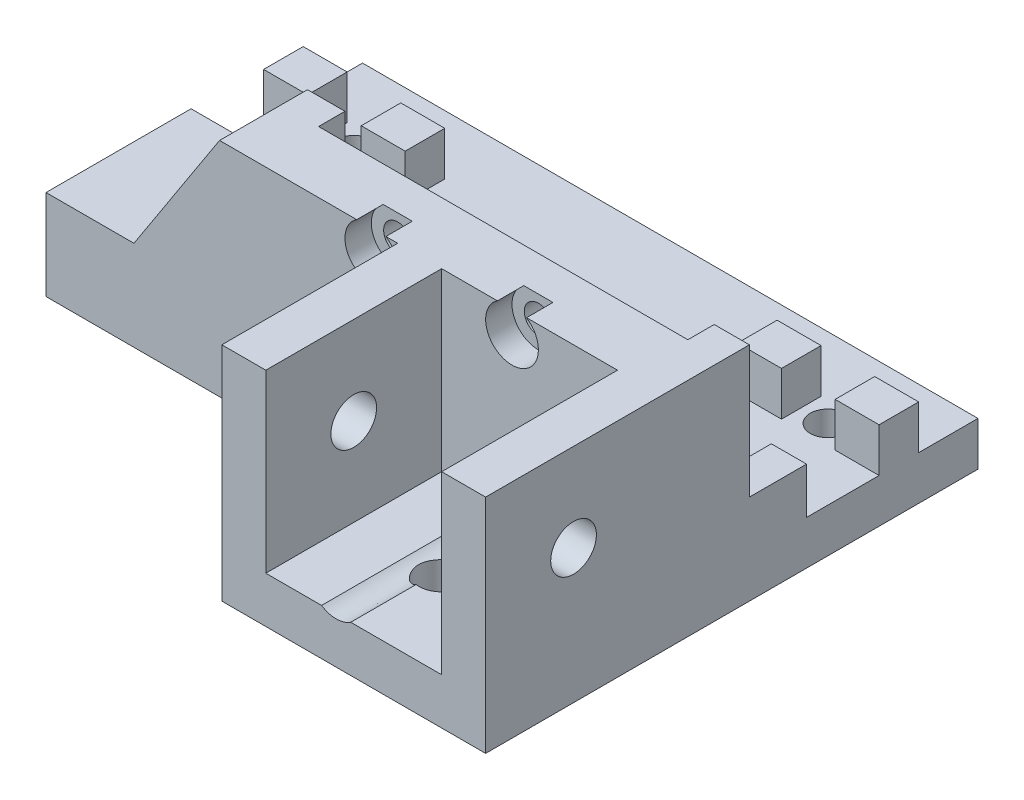
from build123d import *

# Parameters (mm, degrees)
SKETCH1_W           = 40
SKETCH1_H           = 20
SKETCH1_R           = 1.6
BOSS_EXTRUDE1_DEPTH = 7
BOSS_EXTRUDE2_DEPTH = 5
BOSS_EXTRUDE3_DEPTH = 5
BOSS_EXTRUDE4_DEPTH = 0.25
SKETCH5_W           = 50
SKETCH5_H           = 36
BOSS_EXTRUDE5_DEPTH = 5
SKETCH6_R           = 3
CUT_EXTRUDE1_DEPTH  = 3
BOSS_EXTRUDE6_DEPTH = 20
BOSS_EXTRUDE7_DEPTH = 5
BOSS_EXTRUDE8_DEPTH = 20
SKETCH10_R          = 2.6
CUT_EXTRUDE2_DEPTH  = 60.779281528
BOSS_EXTRUDE9_DEPTH = 20
SKETCH12_R          = 2.6
CUT_EXTRUDE3_DEPTH  = 60.190898836
SKETCH13_W          = 5
SKETCH13_H          = 5
CUT_EXTRUDE4_DEPTH  = 6.5
CHAMFER1_SIZE       = 15.398649638
CHAMFER1_SIZE_2     = 10
SKETCH14_W          = 1
SKETCH14_H          = 20.25
CUT_EXTRUDE5_DEPTH  = 10
SKETCH15_R          = 2
CUT_EXTRUDE6_DEPTH  = 10


with BuildPart() as part:
    # Sketch1 → Boss-Extrude1 (new body)
    with BuildSketch(Plane.XY):
        Rectangle(SKETCH1_W, SKETCH1_H)
        with Locations((-8, 7.5)):
            Circle(SKETCH1_R, mode=Mode.SUBTRACT)
        with Locations((8, 7.5)):
            Circle(SKETCH1_R, mode=Mode.SUBTRACT)
        with Locations((8, -7.5)):
            Circle(SKETCH1_R, mode=Mode.SUBTRACT)
        with Locations((-8, -7.5)):
            Circle(SKETCH1_R, mode=Mode.SUBTRACT)
    extrude(amount=BOSS_EXTRUDE1_DEPTH)

    # Sketch2 → Boss-Extrude2 (add)
    with BuildSketch(Plane(origin=(20, 0, 0), x_dir=(0, 0, -1), z_dir=(1, 0, 0))):
        Polygon((3, -5), (3, 5), (9.5, 5), (9.5, 10), (0, 10), (-7, 10), (-7, -10), (0, -10), (9.5, -10), (9.5, -5), align=None)
    extrude(amount=BOSS_EXTRUDE2_DEPTH)

    # Sketch3 → Boss-Extrude3 (add)
    with BuildSketch(Plane.ZY.offset(20)):
        Polygon((7, 10), (-9.5, 10), (-9.5, 5), (-3, 5), (-3, -5), (-9.5, -5), (-9.5, -10), (7, -10), align=None)
    extrude(amount=BOSS_EXTRUDE3_DEPTH)

    # Sketch4 → Boss-Extrude4 (add)
    with BuildSketch(Plane.XZ.offset(10)):
        Polygon((-25, 7), (-25, -9.5), (-20, -9.5), (-20, 0), (20, 0), (20, -9.5), (25, -9.5), (25, 7), align=None)
    extrude(amount=BOSS_EXTRUDE4_DEPTH)

    # Sketch5 → Boss-Extrude5 (add)
    with BuildSketch(Plane.XZ.offset(10.25)):
        with Locations((0, -11)):
            Rectangle(SKETCH5_W, SKETCH5_H)
    extrude(amount=BOSS_EXTRUDE5_DEPTH)

    # Sketch6 → Cut-Extrude1 (cut)
    with BuildSketch(Plane.XY.offset(7)):
        with Locations((-8, 7.5)):
            Circle(SKETCH6_R)
        with Locations((-8, -7.5)):
            Circle(SKETCH6_R)
        with Locations((8, -7.5)):
            Circle(SKETCH6_R)
        with Locations((8, 7.5)):
            Circle(SKETCH6_R)
    extrude(amount=-CUT_EXTRUDE1_DEPTH, mode=Mode.SUBTRACT)

    # Sketch7 → Boss-Extrude6 (add)
    with BuildSketch(Plane.ZY.offset(25)):
        Polygon((-3, -5), (7, -5), (7, -15.25), (-29, -15.25), (-29, -10.25), (-9.5, -10.25), (-9.5, -5), align=None)
    extrude(amount=BOSS_EXTRUDE6_DEPTH)

    # Sketch8 → Boss-Extrude7 (add)
    with BuildSketch(Plane(origin=(0, -10.25, 0), x_dir=(1, 0, 0), z_dir=(0, 1, 0))):
        Polygon((20, 17.75), (20, 22.25), (25, 22.25), (25, 17.75), (22, 17.75), align=None)
        Polygon((13.9, 20), (13.9, 17.75), (11.9, 17.75), (8.9, 17.75), (8.9, 22.25), (13.9, 22.25), align=None)
        Polygon((-28.9, 17.75), (-28.9, 22.25), (-33.9, 22.25), (-33.9, 20), (-33.9, 17.75), (-31.9, 17.75), align=None)
        Polygon((-45, 17.75), (-42, 17.75), (-40, 17.75), (-40, 22.25), (-45, 22.25), align=None)
    extrude(amount=BOSS_EXTRUDE7_DEPTH)

    # Sketch9 → Boss-Extrude8 (add)
    with BuildSketch(Plane.XY.offset(7)):
        Polygon((0, 0), (0, 10), (-5, 10), (-5, -10), (0, -10), align=None)
        Polygon((20, 0), (20, 10), (25, 10), (25, -10), (20, -10), align=None)
    extrude(amount=BOSS_EXTRUDE8_DEPTH)

    # Sketch10 → Cut-Extrude2 (cut, through all)
    with BuildSketch(Plane.ZY.offset(25)):
        with Locations(Location((17, 0, 0), (0, 0, 270))):
            Circle(SKETCH10_R)
    extrude(amount=-CUT_EXTRUDE2_DEPTH, mode=Mode.SUBTRACT)

    # Sketch11 → Boss-Extrude9 (add, through all)
    with BuildSketch(Plane.XY.offset(7)):
        with BuildLine():
            Line((25, -15.25), (25, -10))
            Line((25, -10), (10, -10))
            Line((10, -10), (9.658312395, -10))
            add(Edge.make_bspline(
                [(9.658312395, -10), (9.104622692, -10.372271133), (7.89971927, -10.67517784), (6.757134286, -10.276593696), (6.341687605, -10)],
                knots=[0, 0, 0, 0, 0.571533916, 1, 1, 1, 1], degree=3))
            Line((6.341687605, -10), (-5, -10))
            Line((-5, -10), (-5, -15.25))
            Line((-5, -15.25), (25, -15.25))
        make_face()
    extrude(amount=BOSS_EXTRUDE9_DEPTH)

    # Sketch12 → Cut-Extrude3 (cut, through all)
    with BuildSketch(Plane.XZ.offset(15.25)):
        with Locations(Location((10, 17, 0), (0, 0, 270))):
            Circle(SKETCH12_R)
    extrude(amount=-CUT_EXTRUDE3_DEPTH, mode=Mode.SUBTRACT)

    # Sketch13 → Cut-Extrude4 (cut)
    with BuildSketch(Plane(origin=(0, 0, -9.5), x_dir=(-1, 0, 0), z_dir=(0, 0, -1))):
        with Locations((22.5, 7.5)):
            Rectangle(SKETCH13_W, SKETCH13_H)
        with Locations((-22.5, 7.5)):
            Rectangle(SKETCH13_W, SKETCH13_H)
    extrude(amount=-CUT_EXTRUDE4_DEPTH, mode=Mode.SUBTRACT)

    # Chamfer1
    # the kernel refuses this chamfer: 15.398649638, 10 mm, written as the material it adds along each edge
    with BuildSketch(Plane(origin=(-25, -5, 7), x_dir=(0.021073765466273167, 0.9997779235455604, 0), z_dir=(0, 0, -1))) as chamfer1_piece_1_section:
        Polygon((CHAMFER1_SIZE * 0.999777923555, -CHAMFER1_SIZE * 0.0210737654665), (-CHAMFER1_SIZE_2 * 0.0210737654663, -CHAMFER1_SIZE_2 * 0.999777923546), (0, 0), align=None)
    chamfer1_piece_1 = extrude(amount=10, mode=Mode.PRIVATE)
    chamfer1_piece_1 = split(chamfer1_piece_1, bisect_by=Plane(origin=(-28.252881362, 10, 2), z_dir=(0, -1, 0)), keep=Keep.TOP, mode=Mode.PRIVATE)
    add(chamfer1_piece_1)

    # Sketch14 → Cut-Extrude5 (cut)
    with BuildSketch(Plane(origin=(0, 0, 0), x_dir=(-1, 0, 0), z_dir=(0, 0, -1))):
        with Locations((20.5, -0.125)):
            Rectangle(SKETCH14_W, SKETCH14_H)
        with Locations((-20.5, -0.125)):
            Rectangle(SKETCH14_W, SKETCH14_H)
    extrude(amount=CUT_EXTRUDE5_DEPTH, mode=Mode.SUBTRACT)

    # Sketch15 → Cut-Extrude6 (cut)
    with BuildSketch(Plane(origin=(0, -10.25, 0), x_dir=(1, 0, 0), z_dir=(0, 1, 0))):
        with Locations(Location((16.95, 19.975, 0), (0, 0, 270))):
            Circle(SKETCH15_R)
        with Locations(Location((-36.95, 19.975, 0), (0, 0, 270))):
            Circle(SKETCH15_R)
    extrude(amount=-CUT_EXTRUDE6_DEPTH, mode=Mode.SUBTRACT)


solid = part.part
